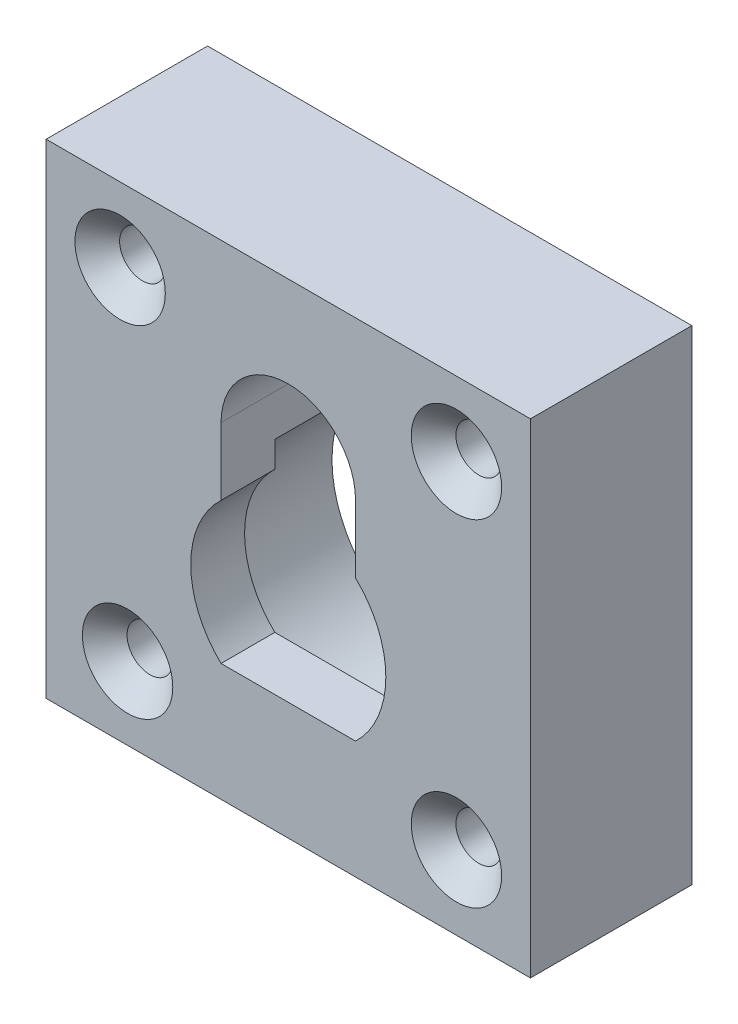
from build123d import *

# Parameters (mm, degrees)
SKETCH1_W                     = 36
SKETCH1_H                     = 36
BOSS_EXTRUDE1_DEPTH           = 12
SKETCH2_R                     = 8.75
CUT_EXTRUDE1_DEPTH            = 8
CUT_EXTRUDE2_REACH            = 28.683
CUT_EXTRUDE3_REACH            = 30.142
CSK_FOR_M3_SFHCS1_D           = 3.4
CSK_FOR_M3_SFHCS1_CSINK_D     = 6.72
CSK_FOR_M3_SFHCS1_CSINK_ANGLE = 90


with BuildPart() as part:
    # Sketch1 → Boss-Extrude1 (new body)
    with BuildSketch(Plane.XY):
        Rectangle(SKETCH1_W, SKETCH1_H)
    extrude(amount=BOSS_EXTRUDE1_DEPTH)

    # Sketch2 → Cut-Extrude1 (cut)
    with BuildSketch(Plane(origin=(0, 0, 0), x_dir=(-1, 0, 0), z_dir=(0, 0, -1))):
        with Locations((0, -4)):
            Circle(SKETCH2_R)
    extrude(amount=-CUT_EXTRUDE1_DEPTH, mode=Mode.SUBTRACT)

    # Sketch3 → Cut-Extrude2 (cut, up to next)
    with BuildSketch(Plane(origin=(0, 0, 8), x_dir=(-1, 0, 0), z_dir=(0, 0, -1)), mode=Mode.PRIVATE) as cut_extrude2_sk1:
        with BuildLine():
            Line((-5, 1.25), (5, 1.25))
            ThreePointArc((5, 1.25), (7.25, -4), (5, -9.25))
            Line((5, -9.25), (-5, -9.25))
            ThreePointArc((-5, -9.25), (-7.25, -4), (-5, 1.25))
        make_face()
    cut_extrude2_tool1 = extrude(cut_extrude2_sk1.sketch, amount=-CUT_EXTRUDE2_REACH, mode=Mode.PRIVATE) & part.part
    add(cut_extrude2_tool1.solids().sort_by_distance((0, -4, 8))[0], mode=Mode.SUBTRACT)

    # Sketch4 → Cut-Extrude3 (cut, up to next)
    with BuildSketch(Plane(origin=(0, 0, 0), x_dir=(-1, 0, 0), z_dir=(0, 0, -1)), mode=Mode.PRIVATE) as cut_extrude3_sk1:
        with BuildLine():
            Line((-5, 6.25), (-5, 1.25))
            Line((-5, 1.25), (5, 1.25))
            Line((5, 1.25), (5, 6.25))
            ThreePointArc((5, 6.25), (0, 11.25), (-5, 6.25))
        make_face()
    cut_extrude3_tool1 = extrude(cut_extrude3_sk1.sketch, amount=-CUT_EXTRUDE3_REACH, mode=Mode.PRIVATE) & part.part
    add(cut_extrude3_tool1.solids().sort_by_distance((0, 5.783251, 0))[0], mode=Mode.SUBTRACT)

    # CSK for M3 SFHCS1 (through all)
    with Locations(Plane.XY.offset(12)):
        with Locations((-11.946611077, -12.577936053), (12.5, -12.5), (12.5, 12.5), (-12.5, 12.5)):
            CounterSinkHole(CSK_FOR_M3_SFHCS1_D / 2, CSK_FOR_M3_SFHCS1_CSINK_D / 2, counter_sink_angle=CSK_FOR_M3_SFHCS1_CSINK_ANGLE)


solid = part.part
